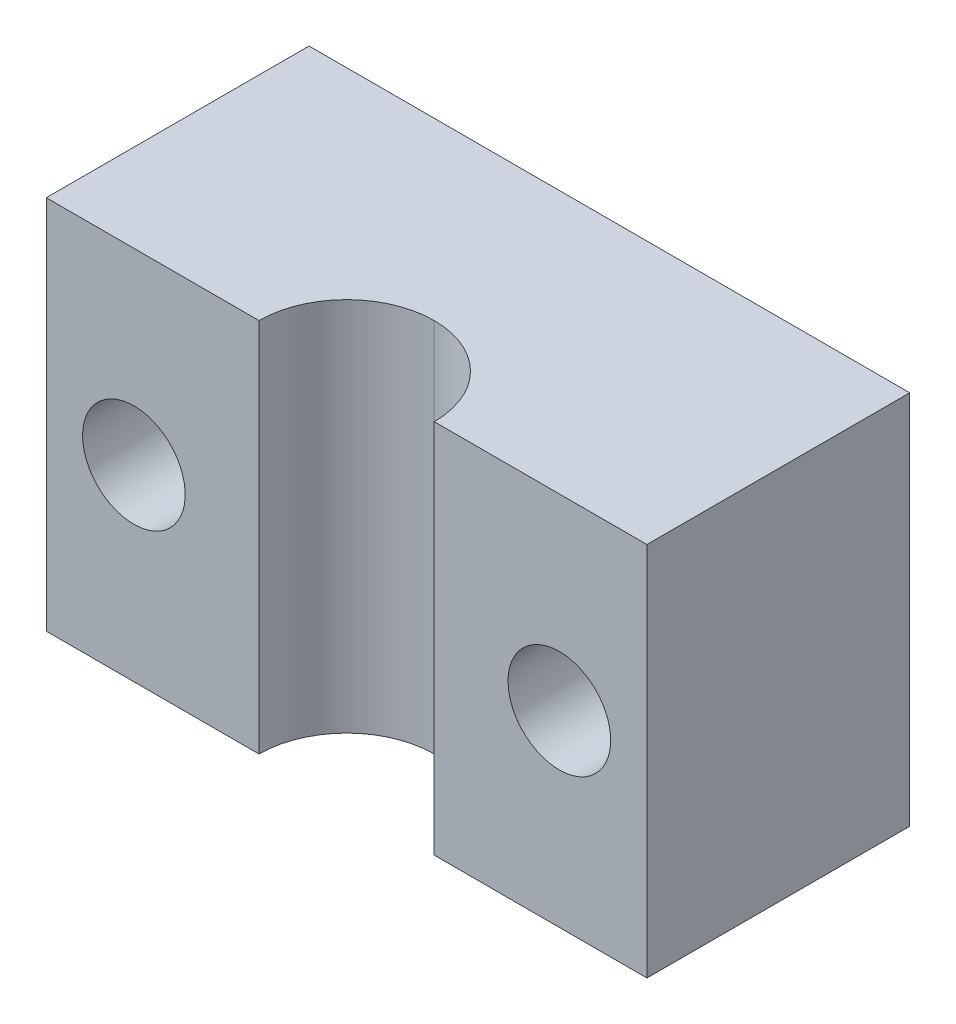
from build123d import *

# Parameters (mm, degrees)
SKETCH_1_W          = 48
SKETCH_1_H          = 20
EXTRUDE_1_DEPTH     = 30
SKETCH_2_W          = 14
SKETCH_2_H          = 30
CUT_EXTRUDE_1_DEPTH = 7
SKETCH_7_W          = 22
SKETCH_7_H          = 30
EXTRUDE_2_DEPTH     = 48
SKETCH_8_W          = 21
SKETCH_8_H          = 30
CUT_EXTRUDE_2_DEPTH = 14
SKETCH_9_W          = 21
SKETCH_9_H          = 30
CUT_EXTRUDE_3_DEPTH = 14
SKETCH_11_W         = 10.2
SKETCH_11_H         = 20.2
CUT_EXTRUDE_4_DEPTH = 56.497747702
SKETCH_13_R         = 4.1
CUT_EXTRUDE_5_DEPTH = 44.783558558
FILLET_1_R          = 7
SKETCH1_W           = 10.2
SKETCH1_H           = 20.2
BOSS_EXTRUDE1_DEPTH = 4
SKETCH2_W           = 20
SKETCH2_H           = 21
CUT_EXTRUDE1_DEPTH  = 51


with BuildPart() as part:
    # Эскиз1 → Бобышка-Вытянуть1 (new body)
    with BuildSketch(Plane(origin=(0, 0, 0), x_dir=(1, 0, 0), z_dir=(0, 1, 0))):
        Rectangle(SKETCH_1_W, SKETCH_1_H)
    extrude(amount=EXTRUDE_1_DEPTH)

    # Эскиз2 → Вырез-Вытянуть1 (cut)
    with BuildSketch(Plane.XY.offset(10)):
        with Locations((0, 15)):
            Rectangle(SKETCH_2_W, SKETCH_2_H)
    extrude(amount=-CUT_EXTRUDE_1_DEPTH, mode=Mode.SUBTRACT)

    # Эскиз7 → Бобышка-Вытянуть2 (add)
    with BuildSketch(Plane(origin=(24, 0, 0), x_dir=(0, 0, -1), z_dir=(1, 0, 0))):
        with Locations((21, 15)):
            Rectangle(SKETCH_7_W, SKETCH_7_H)
    extrude(amount=-EXTRUDE_2_DEPTH)

    # Эскиз8 → Вырез-Вытянуть2 (cut)
    with BuildSketch(Plane(origin=(24, 0, 0), x_dir=(0, 0, -1), z_dir=(1, 0, 0))):
        with Locations((21.5, 15)):
            Rectangle(SKETCH_8_W, SKETCH_8_H)
    extrude(amount=-CUT_EXTRUDE_2_DEPTH, mode=Mode.SUBTRACT)

    # Эскиз9 → Вырез-Вытянуть3 (cut)
    with BuildSketch(Plane.ZY.offset(24)):
        with Locations((-21.5, 15)):
            Rectangle(SKETCH_9_W, SKETCH_9_H)
    extrude(amount=-CUT_EXTRUDE_3_DEPTH, mode=Mode.SUBTRACT)

    # Эскиз11 → Вырез-Вытянуть4 (cut, through all)
    with BuildSketch(Plane.ZY.offset(10)):
        with Locations((-21.5, 15)):
            Rectangle(SKETCH_11_W, SKETCH_11_H)
    extrude(amount=-CUT_EXTRUDE_4_DEPTH, mode=Mode.SUBTRACT)

    # Эскиз13 → Вырез-Вытянуть5 (cut, through all)
    with BuildSketch(Plane(origin=(0, 0, -11), x_dir=(-1, 0, 0), z_dir=(0, 0, -1))):
        with Locations((17, 15)):
            Circle(SKETCH_13_R)
        with Locations((-17, 15)):
            Circle(SKETCH_13_R)
    extrude(amount=-CUT_EXTRUDE_5_DEPTH, mode=Mode.SUBTRACT)

    # Скругление1
    fillet_1_edges = [part.edges().sort_by_distance(p)[0] for p in [
        (-7, 15, 3),
        (7, 15, 3),
    ]]
    fillet(fillet_1_edges, radius=FILLET_1_R - 0.0001)  # a hair under: the kernel refuses the full size

    # Sketch1 → Boss-Extrude1 (add)
    with BuildSketch(Plane(origin=(10, 0, 0), x_dir=(0, 0, -1), z_dir=(1, 0, 0))):
        with Locations((21.5, 15)):
            Rectangle(SKETCH1_W, SKETCH1_H)
    extrude(amount=-BOSS_EXTRUDE1_DEPTH)

    # Sketch2 → Cut-Extrude1 (cut, through all)
    with BuildSketch(Plane(origin=(0, 30, 0), x_dir=(1, 0, 0), z_dir=(0, 1, 0))):
        with Locations((0, 21.5)):
            Rectangle(SKETCH2_W, SKETCH2_H)
    extrude(amount=-CUT_EXTRUDE1_DEPTH, mode=Mode.SUBTRACT)


solid = part.part
